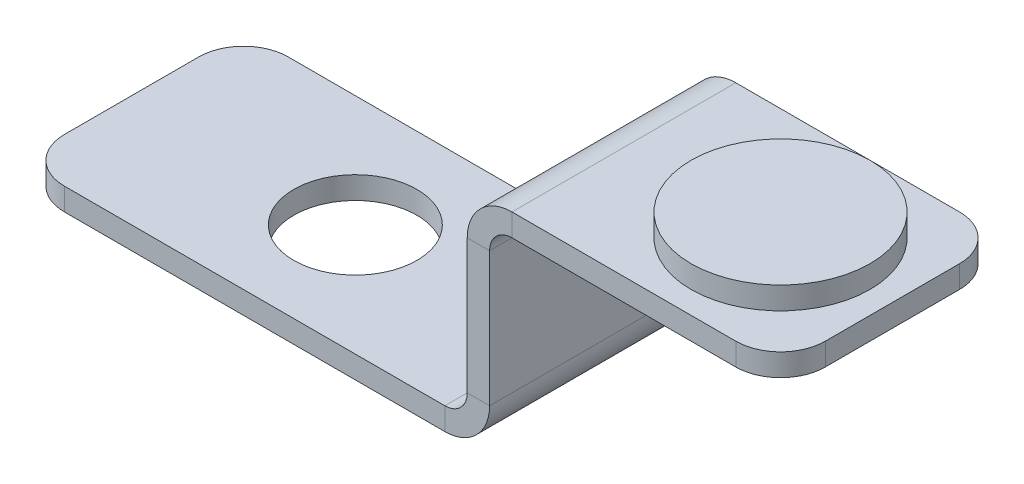
from build123d import *
from build123d.topology import SkipClean

# Parameters (mm, degrees)
SKETCH1_R           = 2.75
BASE_FLANGE1_DEPTH  = 1
JOG1_START          = -10
JOG1_DEPTH          = 10
JOG1_START_2        = -8
JOG1_2_DEPTH        = 6
JOG1_START_3        = 7
JOG1_3_DEPTH        = 1.974011807
JOG1_4_OUTLINE_W    = 1
JOG1_4_OUTLINE_H    = 2
JOG1_4_DEPTH        = 7.152182036
JOG1_START_4        = 8
JOG1_5_DEPTH        = 1
JOG1_6_DEPTH        = 10
JOG1_7_DEPTH        = 10
SKETCH12_R          = 4
BOSS_EXTRUDE1_DEPTH = 1


with BuildPart() as part:
    # Base-Flange1: sheet metal written as solids
    # Sketch1 → Base-Flange1 (new body)
    with BuildSketch(Plane(origin=(0, 0, 0), x_dir=(1, 0, 0), z_dir=(0, 1, 0))):
        with BuildLine():
            Line((0, 2), (0, 8))
            ThreePointArc((0, 8), (0.585786438, 9.414213562), (2, 10))
            Line((2, 10), (32, 10))
            ThreePointArc((32, 10), (33.414213562, 9.414213562), (34, 8))
            Line((34, 8), (34, 2))
            ThreePointArc((34, 2), (33.414213562, 0.585786438), (32, 0))
            Line((32, 0), (2, 0))
            ThreePointArc((2, 0), (0.585786438, 0.585786438), (0, 2))
        make_face()
        with Locations(Location((10, 5, 0), (0, 0, 270))):
            Circle(SKETCH1_R, mode=Mode.SUBTRACT)
    extrude(amount=-BASE_FLANGE1_DEPTH)

    # Jog1: read off the stored shape, not the designer's step
    # Jog1 outline → Jog1 (cut)
    with BuildSketch(Plane.XY.offset(JOG1_START)):
        with BuildLine():
            Line((34, 0), (20.732050807, 0))
            ThreePointArc((20.732050807, 0), (20, -0.732050807), (19, -1))
            Line((19, -1), (34, -1))
            Line((34, -1), (34, 0))
        make_face()
    extrude(amount=JOG1_DEPTH, mode=Mode.SUBTRACT)

    # Jog1 2 outline → Jog1 2 (add)
    with BuildSketch(Plane.XY.offset(JOG1_START_2)):
        with BuildLine():
            Line((21, 1), (21, 7))
            ThreePointArc((21, 7), (21.292893219, 7.707106781), (22, 8))
            Line((22, 8), (34, 8))
            Line((34, 8), (34, 9))
            Line((34, 9), (22, 9))
            ThreePointArc((22, 9), (20.585786438, 8.414213562), (20, 7))
            Line((20, 7), (20, 1))
            ThreePointArc((20, 1), (19.707106781, 0.292893219), (19, 0))
            Line((19, 0), (20.732050807, 0))
            ThreePointArc((20.732050807, 0), (20.931851652, 0.48236191), (21, 1))
        make_face()
    extrude(amount=JOG1_2_DEPTH)

    # Jog1 3 outline → Jog1 3 (add)
    with BuildSketch(Plane(origin=(0, 0, 0), x_dir=(1, 0, 0), z_dir=(0, 1, 0)).offset(JOG1_START_3)):
        with BuildLine():
            Line((20, 10), (20, 8))
            Line((20, 8), (34, 8))
            ThreePointArc((34, 8), (33.414213562, 9.414213562), (32, 10))
            Line((32, 10), (20, 10))
        make_face()
        with BuildLine():
            Line((34, 2), (20, 2))
            Line((20, 2), (20, 0))
            Line((20, 0), (32, 0))
            ThreePointArc((32, 0), (33.414213562, 0.585786438), (34, 2))
        make_face()
    extrude(amount=JOG1_3_DEPTH)

    # Jog1 4 outline → Jog1 4 (add)
    with BuildSketch(Plane(origin=(0, 0, 0), x_dir=(1, 0, 0), z_dir=(0, 1, 0))):
        with Locations((20.5, 9)):
            Rectangle(JOG1_4_OUTLINE_W, JOG1_4_OUTLINE_H)
        with Locations((20.5, 1)):
            Rectangle(JOG1_4_OUTLINE_W, JOG1_4_OUTLINE_H)
    extrude(amount=JOG1_4_DEPTH)

    # Jog1 5 outline → Jog1 5 (add)
    with BuildSketch(Plane(origin=(0, 0, 0), x_dir=(1, 0, 0), z_dir=(0, 1, 0)).offset(JOG1_START_4)):
        with BuildLine():
            Line((32, 10), (21, 10))
            Line((21, 10), (21, 8))
            Line((21, 8), (34, 8))
            ThreePointArc((34, 8), (33.414213562, 9.414213562), (32, 10))
        make_face()
        with BuildLine():
            Line((34, 2), (21, 2))
            Line((21, 2), (21, 0))
            Line((21, 0), (32, 0))
            ThreePointArc((32, 0), (33.414213562, 0.585786438), (34, 2))
        make_face()
    extrude(amount=JOG1_5_DEPTH)

    # Jog1 6 outline → Jog1 6 (cut)
    with SkipClean():  # the faces are left unmerged after this step: merging them gives an invalid solid
        with BuildSketch(Plane.XY.offset(JOG1_START)):
            with BuildLine():
                Line((21, 7), (21, 1))
                ThreePointArc((21, 1), (20.732050807, -1e-09), (19.999999998, -0.732050808))
                Line((19.999999998, -0.732050808), (19.999999995, -1))
                Line((19.999999995, -1), (35, -1))
                Line((35, -1), (35, 8))
                Line((35, 8), (22, 8))
                ThreePointArc((22, 8), (21.292893219, 7.707106781), (21, 7))
            make_face()
            with BuildLine():
                Line((21, 9), (21, 8.974011807))
                Line((21, 8.974011807), (20, 8.974011807))
                Line((20, 8.974011807), (20, 7))
                ThreePointArc((20, 7), (20.585786438, 8.414213562), (22, 9))
                Line((22, 9), (35, 9.000000008))
                Line((35, 9.000000008), (35, 10))
                Line((35, 10), (21.000000006, 10))
                Line((21.000000006, 10), (21, 9))
            make_face()
        extrude(amount=JOG1_6_DEPTH, mode=Mode.SUBTRACT)
    add(part.part.scale(1), mode=Mode.REPLACE)  # the faces are merged on a copy

    # Jog1 7 outline → Jog1 7 (add)
    with BuildSketch(Plane.XY.offset(JOG1_START)):
        with BuildLine():
            ThreePointArc((19, -1), (19.517638089, -0.931851653), (19.999999998, -0.732050808))
            Line((19.999999998, -0.732050808), (19.999999996, 0))
            Line((19.999999996, 0), (20, 1))
            ThreePointArc((20, 1), (19.707106781, 0.292893219), (19, 0))
            Line((19, 0), (18, -1e-09))
            Line((18, -1e-09), (18, -1))
            Line((18, -1), (19, -1))
        make_face()
    extrude(amount=JOG1_7_DEPTH)

    # Sketch12 → Boss-Extrude1 (add)
    with BuildSketch(Plane(origin=(0, 9, 0), x_dir=(1, 0, 0), z_dir=(0, 1, 0))):
        with Locations(Location((29, 5, 0), (0, 0, 180))):
            Circle(SKETCH12_R)
    extrude(amount=BOSS_EXTRUDE1_DEPTH)


solid = part.part
